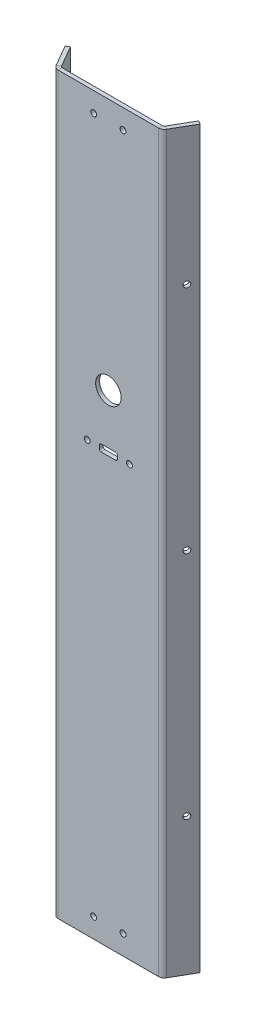
from build123d import *

# Parameters (mm, degrees)
SKETCH_11_W             = 80.498191281
SKETCH_11_H             = 375
SM_BASE_FLANGE_1_DEPTH  = 2
CUT_EXTRUDE_1_DEPTH     = 378.392627604
HOLE_WIZARD_3_0_3_1_D   = 3
HOLE_WIZARD_3_0_3_2_D   = 3
HOLE_WIZARD_13_0_13_1_D = 13
OTHER_1_DEPTH           = 375
OTHER_1_2_DEPTH         = 375
OTHER_START             = -25
OTHER_1_3_OUTLINE_R     = 1.5
OTHER_1_3_DEPTH         = 4
OTHER_START_2           = 33.158957521
OTHER_3_OUTLINE_R       = 1.5
OTHER_3_DEPTH           = 6.841042479
OTHER_3_2_DEPTH         = 375
OTHER_3_3_DEPTH         = 375
OTHER_START_3           = 24
OTHER_3_4_OUTLINE_R     = 1.5
OTHER_3_4_DEPTH         = 4


with BuildPart() as part:
    # 基材-凸緣1: sheet metal written as solids
    # 草圖11 → 基材-凸緣1 (new body)
    with BuildSketch(Plane.XY.offset(4)):
        with Locations((2.132449513, 187.5)):
            Rectangle(SKETCH_11_W, SKETCH_11_H)
    extrude(amount=-SM_BASE_FLANGE_1_DEPTH)

    # 草圖16 → 除料-伸長1 (cut, through all)
    with BuildSketch(Plane(origin=(0, 0, 2), x_dir=(-1, 0, 0), z_dir=(0, 0, -1))):
        with BuildLine():
            Line((1.517550486, 220.75), (-5.782449514, 220.75))
            ThreePointArc((-5.782449514, 220.75), (-6.489556295, 220.457106781), (-6.782449514, 219.75))
            Line((-6.782449514, 219.75), (-6.782449514, 218.25))
            ThreePointArc((-6.782449514, 218.25), (-6.489556295, 217.542893219), (-5.782449514, 217.25))
            Line((-5.782449514, 217.25), (1.517550486, 217.25))
            ThreePointArc((1.517550486, 217.25), (2.224657268, 217.542893219), (2.517550486, 218.25))
            Line((2.517550486, 218.25), (2.517550486, 219.75))
            ThreePointArc((2.517550486, 219.75), (2.224657268, 220.457106781), (1.517550486, 220.75))
        make_face()
    extrude(amount=-CUT_EXTRUDE_1_DEPTH, mode=Mode.SUBTRACT)

    # Ø3.0 (3) 直徑孔1 (through all)
    with Locations(Plane.XY.offset(4)):
        with Locations((37.381545154, 70), (37.381545154, 187.5), (37.381545154, 305), (-33.116646127, 70), (-33.116646127, 187.5), (-33.116646127, 305)):
            Hole(HOLE_WIZARD_3_0_3_1_D / 2)

    # Ø3.0 (3) 直徑孔2 (through all)
    with Locations(Plane(origin=(0, 0, 2), x_dir=(-1, 0, 0), z_dir=(0, 0, -1))):
        with Locations((-12.882449514, 219), (8.617550486, 219), (5.367550486, 10), (-9.632449514, 10), (-9.632449514, 365), (5.367550486, 365)):
            Hole(HOLE_WIZARD_3_0_3_2_D / 2)

    # Ø13.0 (13) 直徑孔1 (through all)
    with Locations(Plane.XY.offset(4)):
        with Locations((2.132449514, 246.25)):
            Hole(HOLE_WIZARD_13_0_13_1_D / 2)

    # Other 1: read off the stored shape, not the designer's step
    # Other 1 outline → Other 1 (cut)
    with BuildSketch(Plane(origin=(0, 0, 0), x_dir=(1, 0, 0), z_dir=(0, 1, 0))):
        with BuildLine():
            Line((-26.042976967, -2.5), (-26.331652102, -2))
            Line((-26.331652102, -2), (-38.116646127, -2))
            Line((-38.116646127, -2), (-38.116646127, -4))
            Line((-38.116646127, -4), (-23.444900756, -4))
            ThreePointArc((-23.444900756, -4), (-24.944900756, -3.598076211), (-26.042976967, -2.5))
        make_face()
    extrude(amount=OTHER_1_DEPTH, mode=Mode.SUBTRACT)

    # Other 1 2 outline → Other 1 2 (add)
    with BuildSketch(Plane(origin=(0, 0, 0), x_dir=(1, 0, 0), z_dir=(0, 1, 0))):
        with BuildLine():
            Line((-30.599601294, 9.392304845), (-32.331652102, 8.392304845))
            Line((-32.331652102, 8.392304845), (-26.331652102, -2))
            Line((-26.331652102, -2), (-23.444900756, -2))
            ThreePointArc((-23.444900756, -2), (-23.944900756, -1.866025404), (-24.310926159, -1.5))
            Line((-24.310926159, -1.5), (-30.599601294, 9.392304845))
        make_face()
    extrude(amount=OTHER_1_2_DEPTH)

    # Other 1 3 outline → Other 1 3 (cut)
    with BuildSketch(Plane(origin=(0, 0, 0), x_dir=(0.4999999999999988, 0, 0.8660254037844395), z_dir=(0.8660254037844393, 0, -0.4999999999999991)).offset(OTHER_START)):
        with Locations((-18.433775243, -305)):
            Circle(OTHER_1_3_OUTLINE_R)
        with Locations((-18.433775243, -187.5)):
            Circle(OTHER_1_3_OUTLINE_R)
        with Locations((-18.433775243, -70)):
            Circle(OTHER_1_3_OUTLINE_R)
    extrude(amount=OTHER_1_3_DEPTH, mode=Mode.SUBTRACT)

    # Other 3: read off the stored shape, not the designer's step
    # Other 3 outline → Other 3 (cut)
    with BuildSketch(Plane(origin=(0, 0, 0), x_dir=(0.500000000000006, 0, -0.8660254037844353), z_dir=(0.8660254037844352, 0, 0.5000000000000061)).offset(OTHER_START_2)):
        with Locations((20.566224757, 70)):
            Circle(OTHER_3_OUTLINE_R)
        with Locations((20.566224757, 187.5)):
            Circle(OTHER_3_OUTLINE_R)
        with Locations((20.566224757, 305)):
            Circle(OTHER_3_OUTLINE_R)
    extrude(amount=OTHER_3_DEPTH, mode=Mode.SUBTRACT)

    # Other 3 2 outline → Other 3 2 (cut)
    with BuildSketch(Plane(origin=(0, 0, 0), x_dir=(1, 0, 0), z_dir=(0, 1, 0))):
        with BuildLine():
            Line((42.381545154, -2), (30.596551129, -2))
            Line((30.596551129, -2), (30.307875994, -2.5))
            ThreePointArc((30.307875994, -2.5), (29.209799783, -3.598076211), (27.709799783, -4))
            Line((27.709799783, -4), (42.381545154, -4))
            Line((42.381545154, -4), (42.381545154, -2))
        make_face()
    extrude(amount=OTHER_3_2_DEPTH, mode=Mode.SUBTRACT)

    # Other 3 3 outline → Other 3 3 (add)
    with BuildSketch(Plane(origin=(0, 0, 0), x_dir=(1, 0, 0), z_dir=(0, 1, 0))):
        with BuildLine():
            Line((34.864500321, 9.392304845), (28.575825186, -1.5))
            ThreePointArc((28.575825186, -1.5), (28.209799783, -1.866025404), (27.709799783, -2))
            Line((27.709799783, -2), (30.596551129, -2))
            Line((30.596551129, -2), (36.596551129, 8.392304845))
            Line((36.596551129, 8.392304845), (34.864500321, 9.392304845))
        make_face()
    extrude(amount=OTHER_3_3_DEPTH)

    # Other 3 4 outline → Other 3 4 (cut)
    with BuildSketch(Plane(origin=(0, 0, 0), x_dir=(0.500000000000006, 0, -0.8660254037844353), z_dir=(0.8660254037844352, 0, 0.5000000000000061)).offset(OTHER_START_3)):
        with Locations((20.566224757, 70)):
            Circle(OTHER_3_4_OUTLINE_R)
        with Locations((20.566224757, 187.5)):
            Circle(OTHER_3_4_OUTLINE_R)
        with Locations((20.566224757, 305)):
            Circle(OTHER_3_4_OUTLINE_R)
    extrude(amount=OTHER_3_4_DEPTH, mode=Mode.SUBTRACT)


solid = part.part
